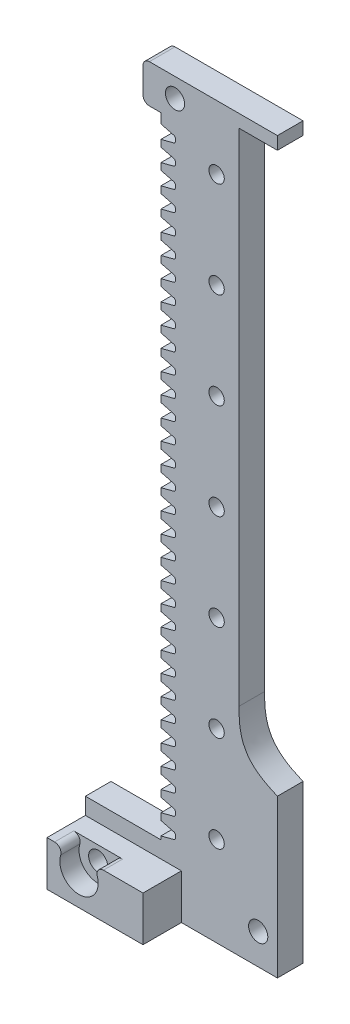
from build123d import *

# Parameters (mm, degrees)
EXTRUDECI_DEPTH               = 2
EXTRUDECI_DEPTH_BACK          = 2
SKETCHCI_M_STRSKETCHNAME_W    = 12.199999985
SKETCHCI_M_STRSKETCHNAME_H    = 97.389370798
TOOTHEXTRUDECUTSPURGEAR_DEPTH = 2
PATTERNSPURGEAR_COUNT         = 31
PATTERNSPURGEAR_PITCH         = 3.141592654
SKETCH1_R                     = 1.2
CUT_EXTRUDE1_DEPTH            = 30
SKETCH2_R                     = 1.5
BOSS_EXTRUDE1_DEPTH           = 4
SKETCH3_R                     = 1.5
BOSS_EXTRUDE2_DEPTH           = 4
FILLET1_START                 = -2
FILLET1_DEPTH                 = 4
BOSS_EXTRUDE4_START           = 6
SKETCH6_W                     = 15
SKETCH6_H                     = 7
SKETCH6_R                     = 1.5
BOSS_EXTRUDE4_DEPTH           = 6
SKETCH7_R                     = 3
CUT_EXTRUDE2_DEPTH            = 3
FILLET2_R                     = 1


with BuildPart() as part:
    # SketchCI.m_strSketchName → ExtrudeCI (new, two sides: drawn at the far end of the back side and taken through both)
    with BuildSketch(Plane.XY.offset(-EXTRUDECI_DEPTH_BACK)):
        with Locations((5.100000008, -47.123889096)):
            Rectangle(SKETCHCI_M_STRSKETCHNAME_W, SKETCHCI_M_STRSKETCHNAME_H)
    extrude(amount=EXTRUDECI_DEPTH + EXTRUDECI_DEPTH_BACK)

    # SketchToothSpurGear → ToothExtrudeCutSpurGear (cut, symmetric)
    with BuildSketch(Plane.XY):
        with BuildLine():
            Line((-0.999999985, 1.044015732), (-0.999999985, -1.044015732))
            Line((-0.999999985, -1.044015732), (1.025913986, -0.520078755))
            ThreePointArc((1.025913986, -0.520078755), (1.188006854, -0.413299648), (1.250799981, -0.229634467))
            Line((1.250799981, -0.229634467), (1.250799981, 0.229634467))
            ThreePointArc((1.250799981, 0.229634467), (1.188006854, 0.413299648), (1.025913986, 0.520078755))
            Line((1.025913986, 0.520078755), (-0.999999985, 1.044015732))
        make_face()
    toothextrudecutspurgear = extrude(amount=TOOTHEXTRUDECUTSPURGEAR_DEPTH, both=True, mode=Mode.SUBTRACT)

    # PatternSpurGear: ToothExtrudeCutSpurGear ×31
    with Locations(*[(0, -i * PATTERNSPURGEAR_PITCH, 0) for i in range(1, PATTERNSPURGEAR_COUNT)]):
        add(toothextrudecutspurgear, mode=Mode.SUBTRACT)

    # Sketch1 → Cut-Extrude1 (cut)
    with BuildSketch(Plane.XY.offset(2)):
        with Locations((7.7, -91.429203697)):
            Circle(SKETCH1_R)
        with Locations((7.7, -76.429203697)):
            Circle(SKETCH1_R)
        with Locations((7.7, -61.429203697)):
            Circle(SKETCH1_R)
        with Locations((7.7, -46.429203697)):
            Circle(SKETCH1_R)
        with Locations((7.7, -31.429203697)):
            Circle(SKETCH1_R)
        with Locations((7.7, -16.429203697)):
            Circle(SKETCH1_R)
        with Locations((7.7, -1.429203697)):
            Circle(SKETCH1_R)
    extrude(amount=-CUT_EXTRUDE1_DEPTH, mode=Mode.SUBTRACT)

    # Sketch2 → Boss-Extrude1 (add, through all)
    with BuildSketch(Plane.XY.offset(2)):
        with BuildLine():
            Line((-0.999999985, 1.570796303), (-0.999999985, 2.570796303))
            Line((-0.999999985, 2.570796303), (-2.799999985, 2.570796303))
            ThreePointArc((-2.799999985, 2.570796303), (-3.507106766, 2.863689522), (-3.799999985, 3.570796303))
            Line((-3.799999985, 3.570796303), (-3.799999985, 7.570796303))
            ThreePointArc((-3.799999985, 7.570796303), (-3.507106766, 8.277903084), (-2.799999985, 8.570796303))
            Line((-2.799999985, 8.570796303), (17.200000015, 8.570796303))
            Line((17.200000015, 8.570796303), (17.200000015, 6.570796303))
            Line((17.200000015, 6.570796303), (11.2, 6.570796303))
            Line((11.2, 6.570796303), (11.2, 1.570796303))
            Line((11.2, 1.570796303), (-0.999999985, 1.570796303))
        make_face()
        with Locations((1.200000015, 5.570796303)):
            Circle(SKETCH2_R, mode=Mode.SUBTRACT)
    extrude(amount=-BOSS_EXTRUDE1_DEPTH)

    # Sketch3 → Boss-Extrude2 (add, through all)
    with BuildSketch(Plane.XY.offset(2)):
        Polygon((-0.999999985, -95.818574495), (-12.799999985, -95.818574495), (-12.799999985, -105.418574495), (17.200000015, -105.418574495), (17.200000015, -95.818574495), (17.200000015, -80.818574495), (11.200000015, -80.818574495), (11.200000015, -95.818574495), align=None)
        with Locations((-7.799999985, -100.618574495)):
            Circle(SKETCH3_R, mode=Mode.SUBTRACT)
        with Locations((14.200000015, -100.618574495)):
            Circle(SKETCH3_R, mode=Mode.SUBTRACT)
    extrude(amount=-BOSS_EXTRUDE2_DEPTH)

    # Fillet1: read off the stored shape, not the designer's step
    # Fillet1 outline → Fillet1 (add)
    with BuildSketch(Plane.XY.offset(FILLET1_START)):
        with BuildLine():
            add(Edge.make_bspline(
                [(11.2, -71.653423099), (11.2, -72.815400764), (11.2, -73.977378429), (11.543379815, -76.567637831), (12.833399739, -78.53817581), (15.070059771, -79.888992367), (16.135029893, -80.353783431), (17.200000015, -80.818574495)],
                knots=[0, 0, 0, 0, 0, 0, 0.5, 0.5, 1, 1, 1, 1, 1, 1], degree=5))
            Line((11.2, -71.653423099), (11.2, -80.818574495))
            Line((11.2, -80.818574495), (17.200000015, -80.818574495))
        make_face()
    extrude(amount=FILLET1_DEPTH)

    # Sketch6 → Boss-Extrude4 (add)
    with BuildSketch(Plane.XY.offset(2).offset(BOSS_EXTRUDE4_START)):
        with Locations((-5.299999985, -101.918574495)):
            Rectangle(SKETCH6_W, SKETCH6_H)
        with Locations((-7.799999985, -100.618574495)):
            Circle(SKETCH6_R, mode=Mode.SUBTRACT)
    extrude(amount=-BOSS_EXTRUDE4_DEPTH)

    # Sketch7 → Cut-Extrude2 (cut)
    with BuildSketch(Plane.XY.offset(8)):
        with Locations((-7.799999985, -100.618574495)):
            Circle(SKETCH7_R)
    extrude(amount=-CUT_EXTRUDE2_DEPTH, mode=Mode.SUBTRACT)

    # Fillet2
    fillet2_edges = [part.edges().sort_by_distance(p)[0] for p in [
        (-9.83960779, -98.418574495, 6.5),
        (-5.76039218, -98.418574495, 6.5),
    ]]
    fillet(fillet2_edges, radius=FILLET2_R)


solid = part.part
